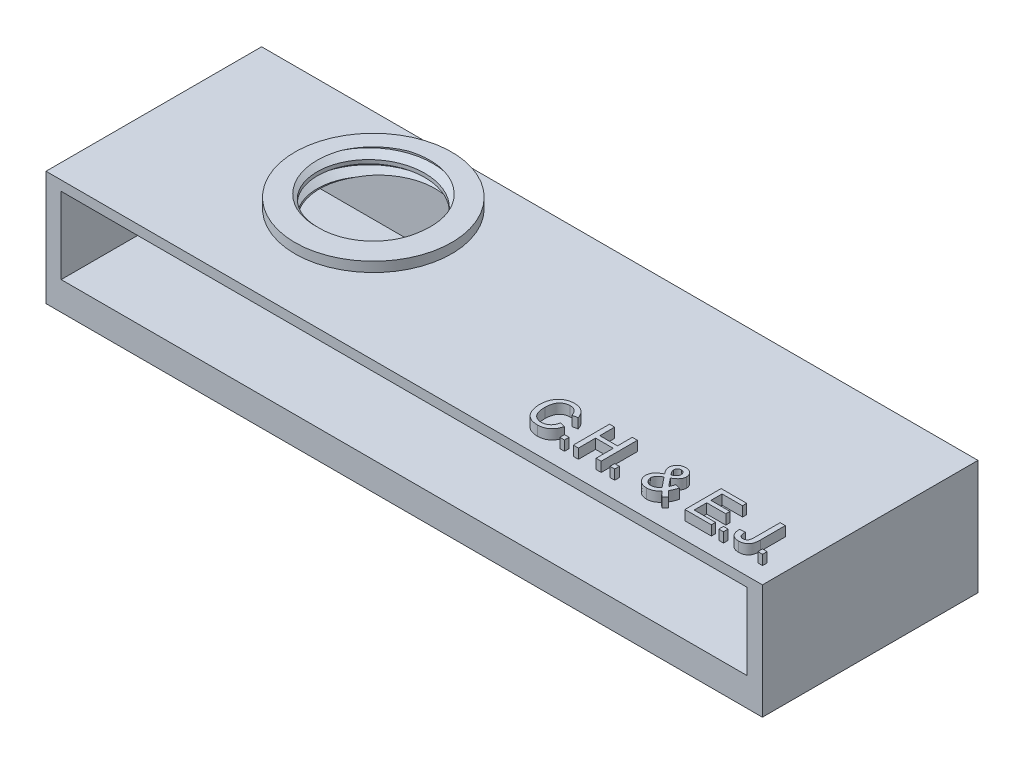
from build123d import *

# Parameters (mm, degrees)
SKIZZE1_W                       = 73.1
SKIZZE1_H                       = 22
BASIS_DEPTH                     = 11.7
SKIZZE2_W                       = 70
SKIZZE2_H                       = 7.8
HANDYSCHLITZ_DEPTH              = 21.25
SKIZZE3_R                       = 6.3
ZYLINDER_DEPTH                  = 1
SKIZZE6_R                       = 8
AUFSATZ_LINEAR_AUSTRAGEN1_DEPTH = 1
SKIZZE8_R                       = 6.3
SCHNITT_LINEAR_AUSTRAGEN2_DEPTH = 6
GEWINDE2_PITCH                  = 1.5
SKIZZE12_R                      = 7.5
SCHNITT_LINEAR_AUSTRAGEN5_DEPTH = 6
SKIZZE17_W                      = 30.300932881
SKIZZE17_H                      = 16.269400137
SCHNITT_LINEAR_AUSTRAGEN7_DEPTH = 6
EAH_JENA_DEPTH                  = 1
LOGO_DEPTH                      = 1
SKIZZE26_W                      = 0.474358974
SKIZZE26_H                      = 0.474358974
SKIZZE26_W_2                    = 0.474358975
C_H_E_J_DEPTH                   = 1


with BuildPart() as part:
    # Skizze1 → Basis (new body)
    with BuildSketch(Plane(origin=(0, 0, 0), x_dir=(1, 0, 0), z_dir=(0, 1, 0))):
        with Locations((-9.866464149, 7.203333333)):
            Rectangle(SKIZZE1_W, SKIZZE1_H)
    extrude(amount=BASIS_DEPTH)

    # Skizze2 → Handyschlitz (cut)
    with BuildSketch(Plane.XY.offset(3.796666667)):
        with Locations((-9.866464149, 6.8)):
            Rectangle(SKIZZE2_W, SKIZZE2_H)
    extrude(amount=-HANDYSCHLITZ_DEPTH, mode=Mode.SUBTRACT)

    # Skizze3 → Zylinder (add)
    with BuildSketch(Plane(origin=(0, 11.7, 0), x_dir=(1, 0, 0), z_dir=(0, 1, 0))):
        with Locations(Location((-26.416464149, 9.603333333, 0), (0, 0, 270))):
            Circle(SKIZZE3_R)
    extrude(amount=ZYLINDER_DEPTH)

    # Skizze6 → Aufsatz-Linear austragen1 (add)
    with BuildSketch(Plane(origin=(0, 11.7, 0), x_dir=(1, 0, 0), z_dir=(0, 1, 0))):
        with Locations(Location((-26.416464149, 9.603333333, 0), (0, 0, 270))):
            Circle(SKIZZE6_R)
    extrude(amount=AUFSATZ_LINEAR_AUSTRAGEN1_DEPTH)

    # Skizze8 → Schnitt-Linear austragen2 (cut)
    with BuildSketch(Plane(origin=(0, 12.7, 0), x_dir=(1, 0, 0), z_dir=(0, 1, 0))):
        with Locations(Location((-26.416464149, 9.603333333, 0), (0, 0, 270))):
            Circle(SKIZZE8_R)
    extrude(amount=-SCHNITT_LINEAR_AUSTRAGEN2_DEPTH, mode=Mode.SUBTRACT)

    # Gewinde2: the profile of Gewindeprofil2 profile screwed along a right-hand helix of 5.333333 turns, 8 arcs to a turn; built about Z, then put on its axis
    gewinde2_z = Axis((0, 0, 0), (0, 0, 1))
    gewinde2_corners = [(6.3003, 0, -0.000173205), (6.3003, 0, 1.312673201), (5.488101187, 0, 0.843749998), (5.488101187, 0, 0.468749998)]
    with BuildLine(mode=Mode.PRIVATE) as gewinde2_profile:
        Line(gewinde2_corners[0], gewinde2_corners[1])
        Line(gewinde2_corners[1], gewinde2_corners[2])
        Line(gewinde2_corners[2], gewinde2_corners[3])
        Line(gewinde2_corners[3], gewinde2_corners[0])
    gewinde2_cap = Face(gewinde2_profile.wire())
    gewinde2_turn_angles = [0, 22.5, 45, 67.5, 90, 112.5, 135, 157.5, 180, 202.5, 225, 247.5, 270, 292.5, 315, 337.5, 360]
    gewinde2_turn_weights = [1, 0.9238795325112867, 1, 0.9238795325112867, 1, 0.9238795325112867, 1, 0.9238795325112867, 1, 0.9238795325112867, 1, 0.9238795325112867, 1, 0.9238795325112867, 1, 0.9238795325112867, 1]
    gewinde2_turn_rails = [Edge.make_bspline([Vector(p[0], p[1], 0).rotate(gewinde2_z, gewinde2_turn_angles[k]) / gewinde2_turn_weights[k] + Vector(0, 0, p[2] + GEWINDE2_PITCH * gewinde2_turn_angles[k] / 360) for k in range(17)], [0, 0, 0, 1, 1, 2, 2, 3, 3, 4, 4, 5, 5, 6, 6, 7, 7, 8, 8, 8], 2, gewinde2_turn_weights) for p in gewinde2_corners]
    gewinde2_turn_sides = [Face.make_surface_from_curves(gewinde2_turn_rails[p[0]], gewinde2_turn_rails[p[1]]) for p in [(0, 1), (1, 2), (2, 3), (3, 0)]]
    gewinde2_last_angles = [1800, 1822.5, 1845, 1867.5, 1890, 1905, 1920]
    gewinde2_last_weights = [1, 0.9238795325112867, 1, 0.9238795325112867, 1, 0.9659258262890688, 1]
    gewinde2_last_rails = [Edge.make_bspline([Vector(p[0], p[1], 0).rotate(gewinde2_z, gewinde2_last_angles[k]) / gewinde2_last_weights[k] + Vector(0, 0, p[2] + GEWINDE2_PITCH * gewinde2_last_angles[k] / 360) for k in range(7)], [0, 0, 0, 1, 1, 2, 2, 3, 3, 3], 2, gewinde2_last_weights) for p in gewinde2_corners]
    gewinde2_last_sides = [Face.make_surface_from_curves(gewinde2_last_rails[p[0]], gewinde2_last_rails[p[1]]) for p in [(0, 1), (1, 2), (2, 3), (3, 0)]]
    gewinde2 = Plane(origin=(-26.416464149, 14.3, -9.603333333), x_dir=(-1, 0, 0), z_dir=(0, -1, 0)) * Solid(Shell([*[p.moved(Location((0, 0, GEWINDE2_PITCH * i))) for i in range(5) for p in gewinde2_turn_sides], *gewinde2_last_sides, gewinde2_cap, gewinde2_cap.rotate(gewinde2_z, 1920).moved(Location((0, 0, GEWINDE2_PITCH * 1920 / 360)))]))
    add(gewinde2)

    # Skizze12 → Schnitt-Linear austragen5 (cut)
    with BuildSketch(Plane(origin=(0, 12.7, 0), x_dir=(1, 0, 0), z_dir=(0, 1, 0))):
        with Locations((-26.416464149, 9.603333333)):
            Circle(SKIZZE12_R)
    extrude(amount=SCHNITT_LINEAR_AUSTRAGEN5_DEPTH, mode=Mode.SUBTRACT)

    # Skizze17 → Schnitt-Linear austragen7 (cut)
    with BuildSketch(Plane(origin=(0, 10.7, 0), x_dir=(-1, 0, 0), z_dir=(0, -1, 0))):
        with Locations((28.531838804, 8.134700069)):
            Rectangle(SKIZZE17_W, SKIZZE17_H)
    extrude(amount=SCHNITT_LINEAR_AUSTRAGEN7_DEPTH, mode=Mode.SUBTRACT)

    # Skizze25 → EAH Jena (add)
    # profile 1 of 7: a face of its own
    with BuildSketch(Plane(origin=(0, 0, 0), x_dir=(-1, 0, 0), z_dir=(0, -1, 0))):
        Polygon((6.791710178, -1.663041856), (6.791710178, 1.836958144), (9.259658895, 1.836958144), (9.259658895, 1.43311199), (7.285299921, 1.43311199), (7.285299921, 0.356188913), (9.125043511, 0.356188913), (9.125043511, -0.047657241), (7.285299921, -0.047657241), (7.285299921, -1.259195702), (9.349402485, -1.259195702), (9.349402485, -1.663041856), align=None)
    # profile 2 of 7: a face of its own
    with BuildSketch(Plane(origin=(0, 0, 0), x_dir=(-1, 0, 0), z_dir=(0, -1, 0))):
        Polygon((9.543613222, -1.663041856), (10.93323662, 1.836958144), (11.489927325, 1.836958144), (12.879550722, -1.663041856), (12.355812742, -1.663041856), (11.957575562, -0.586118779), (10.465588383, -0.586118779), (10.067351203, -1.663041856), align=None)
        with BuildLine():
            Line((10.614226203, -0.182272625), (11.808937742, -0.182272625))
            Line((11.808937742, -0.182272625), (11.468893671, 0.737599169))
            add(Edge.make_bspline(
                [(11.468893671, 0.737599169), (11.455857596, 0.773141762), (11.430369606, 0.842634241), (11.392359336, 0.943600948), (11.357633765, 1.039483076), (11.323582491, 1.128905814), (11.292843798, 1.213168117), (11.264511156, 1.291700831), (11.236490413, 1.363958117), (11.219674771, 1.410643768), (11.211581972, 1.43311199)],
                knots=[0, 0, 0, 0, 1.225184869, 2.395467751, 3.491410812, 4.525364584, 5.492066482, 6.394148129, 7.227157926, 8, 8, 8, 8], degree=3))
            add(Edge.make_bspline(
                [(11.211581972, 1.43311199), (11.198194921, 1.377707334), (11.171365621, 1.266669571), (11.115191597, 1.103984353), (11.050930465, 0.942786964), (10.998742768, 0.838912467), (10.97249944, 0.786677695)],
                knots=[0, 0, 0, 0, 0.9891762, 1.982431084, 2.985436691, 4, 4, 4, 4], degree=3))
            Line((10.97249944, 0.786677695), (10.614226203, -0.182272625))
        make_face(mode=Mode.SUBTRACT)
    # profile 3 of 7: a face of its own
    with BuildSketch(Plane(origin=(0, 0, 0), x_dir=(-1, 0, 0), z_dir=(0, -1, 0))):
        Polygon((13.253248639, -1.663041856), (13.253248639, 1.836958144), (13.746838383, 1.836958144), (13.746838383, 0.401060708), (15.451966588, 0.401060708), (15.451966588, 1.836958144), (15.945556331, 1.836958144), (15.945556331, -1.663041856), (15.451966588, -1.663041856), (15.451966588, -0.002785446), (13.746838383, -0.002785446), (13.746838383, -1.663041856), align=None)
    # profile 4 of 7: a face of its own
    with BuildSketch(Plane(origin=(0, 0, 0), x_dir=(-1, 0, 0), z_dir=(0, -1, 0))):
        with BuildLine():
            Line((17.830171716, -0.686379196), (18.32376146, -0.630990574))
            add(Edge.make_bspline(
                [(18.32376146, -0.630990574), (18.325095054, -0.662092888), (18.327646186, -0.721590801), (18.336104163, -0.807008212), (18.347911279, -0.884697448), (18.36253253, -0.954942231), (18.379565969, -1.017791317), (18.400937234, -1.072737648), (18.423953924, -1.120935667), (18.452253265, -1.16088606), (18.482595025, -1.195029748), (18.515973611, -1.224020964), (18.55195843, -1.248725405), (18.590477759, -1.269133188), (18.631964985, -1.28478687), (18.67598885, -1.295660465), (18.722912253, -1.30318799), (18.755153505, -1.303768279), (18.771778286, -1.304067497)],
                knots=[0, 0, 0, 0, 1.632619403, 3.123158228, 4.499702462, 5.75227728, 6.885496867, 7.90993266, 8.841891104, 9.678429245, 10.468404694, 11.232957398, 11.991194639, 12.753385178, 13.513799276, 14.310593147, 15.128879333, 16, 16, 16, 16], degree=3))
            add(Edge.make_bspline(
                [(18.771778286, -1.304067497), (18.795948594, -1.303258637), (18.843177355, -1.301678124), (18.910921454, -1.28543416), (18.974042611, -1.261062533), (19.030755547, -1.22547634), (19.081319043, -1.182174894), (19.124329594, -1.131076481), (19.157092165, -1.072023015), (19.177726711, -1.017500544), (19.190384105, -0.968972917), (19.198667701, -0.926815945), (19.205651202, -0.879785295), (19.210925971, -0.827586205), (19.216281114, -0.770370123), (19.218420462, -0.70788694), (19.220914052, -0.64059173), (19.221100747, -0.594067985), (19.221197357, -0.569992978)],
                knots=[0, 0, 0, 0, 1.177507829, 2.300849353, 3.381033894, 4.466744326, 5.550475886, 6.619462111, 7.707386998, 8.830091395, 9.455333453, 10.153234525, 10.925888378, 11.774835866, 12.713513529, 13.729654905, 14.82514671, 16, 16, 16, 16], degree=3))
            Line((19.221197357, -0.569992978), (19.221197357, 1.836958144))
            Line((19.221197357, 1.836958144), (19.714787101, 1.836958144))
            Line((19.714787101, 1.836958144), (19.714787101, -0.538442497))
            add(Edge.make_bspline(
                [(19.714787101, -0.538442497), (19.714585465, -0.573971391), (19.714195247, -0.64272918), (19.709274699, -0.742842863), (19.70071679, -0.83682133), (19.689966548, -0.924870761), (19.675220284, -1.006805068), (19.656977905, -1.082350925), (19.636304717, -1.152121748), (19.603857092, -1.235394111), (19.554453955, -1.329868022), (19.478858362, -1.430064774), (19.387489561, -1.515539903), (19.281383393, -1.585889093), (19.163086158, -1.640180619), (19.034637285, -1.679598823), (18.896333766, -1.703992263), (18.800627436, -1.706582551), (18.751445754, -1.707913651)],
                knots=[0, 0, 0, 0, 0.979376435, 1.895351937, 2.762129694, 3.580429744, 4.339931879, 5.055623694, 5.722093767, 6.344240595, 7.517202841, 8.648554164, 9.788057829, 10.949533591, 12.142879013, 13.363546981, 14.645176409, 16, 16, 16, 16], degree=3))
            add(Edge.make_bspline(
                [(18.751445754, -1.707913651), (18.714948055, -1.707116316), (18.643854654, -1.705563197), (18.540496883, -1.693216986), (18.443373338, -1.674648981), (18.353691663, -1.644782191), (18.269632392, -1.609837507), (18.192822629, -1.564925889), (18.121947614, -1.513107367), (18.058801793, -1.452160372), (18.0018615, -1.384064763), (17.954778148, -1.306698621), (17.913168703, -1.222861112), (17.88175556, -1.130217094), (17.855988431, -1.03048475), (17.840050493, -0.922391611), (17.82958188, -0.80694885), (17.829971513, -0.727303214), (17.830171716, -0.686379196)],
                knots=[0, 0, 0, 0, 1.110149412, 2.162445788, 3.163771351, 4.112774839, 5.033433762, 5.928696445, 6.813333667, 7.698542325, 8.592646346, 9.506220098, 10.44759987, 11.434914499, 12.476633792, 13.577933972, 14.755478919, 16, 16, 16, 16], degree=3))
        make_face()
    # profile 5 of 7: a face of its own
    with BuildSketch(Plane(origin=(0, 0, 0), x_dir=(-1, 0, 0), z_dir=(0, -1, 0))):
        Polygon((20.522479408, -1.663041856), (20.522479408, 1.836958144), (22.990428126, 1.836958144), (22.990428126, 1.43311199), (21.016069152, 1.43311199), (21.016069152, 0.356188913), (22.855812742, 0.356188913), (22.855812742, -0.047657241), (21.016069152, -0.047657241), (21.016069152, -1.259195702), (23.080171716, -1.259195702), (23.080171716, -1.663041856), align=None)
    # profile 6 of 7: a face of its own
    with BuildSketch(Plane(origin=(0, 0, 0), x_dir=(-1, 0, 0), z_dir=(0, -1, 0))):
        Polygon((23.753248639, -1.663041856), (23.753248639, 1.836958144), (24.274883254, 1.836958144), (25.951966588, -0.774720542), (25.951966588, 1.836958144), (26.445556331, 1.836958144), (26.445556331, -1.663041856), (25.923921716, -1.663041856), (24.246838383, 0.94863683), (24.246838383, -1.663041856), align=None)
    # profile 7 of 7: a face of its own
    with BuildSketch(Plane(origin=(0, 0, 0), x_dir=(-1, 0, 0), z_dir=(0, -1, 0))):
        Polygon((26.774382453, -1.663041856), (28.164005851, 1.836958144), (28.720696556, 1.836958144), (30.110319953, -1.663041856), (29.586581972, -1.663041856), (29.188344793, -0.586118779), (27.696357613, -0.586118779), (27.298120434, -1.663041856), align=None)
        with BuildLine():
            Line((27.844995434, -0.182272625), (29.039706972, -0.182272625))
            Line((29.039706972, -0.182272625), (28.699662902, 0.737599169))
            add(Edge.make_bspline(
                [(28.699662902, 0.737599169), (28.686626826, 0.773141762), (28.661138837, 0.842634241), (28.623128566, 0.943600948), (28.588402995, 1.039483076), (28.554351722, 1.128905814), (28.523613028, 1.213168117), (28.495280387, 1.291700831), (28.467259644, 1.363958117), (28.450444002, 1.410643768), (28.442351203, 1.43311199)],
                knots=[0, 0, 0, 0, 1.225184869, 2.395467751, 3.491410812, 4.525364584, 5.492066482, 6.394148129, 7.227157926, 8, 8, 8, 8], degree=3))
            add(Edge.make_bspline(
                [(28.442351203, 1.43311199), (28.428964152, 1.377707334), (28.402134851, 1.266669571), (28.345960828, 1.103984353), (28.281699695, 0.942786964), (28.229511999, 0.838912467), (28.203268671, 0.786677695)],
                knots=[0, 0, 0, 0, 0.9891762, 1.982431084, 2.985436691, 4, 4, 4, 4], degree=3))
            Line((28.203268671, 0.786677695), (27.844995434, -0.182272625))
        make_face(mode=Mode.SUBTRACT)
    extrude(amount=EAH_JENA_DEPTH)

    # Skizze24 → LOGO (add)
    with BuildSketch(Plane(origin=(0, 0, 0), x_dir=(-1, 0, 0), z_dir=(0, -1, 0))):
        Polygon((33.761487263, 1.43405578), (32.029436456, -1.56594422), (35.493538071, -1.56594422), align=None)
        Polygon((35.947767039, -1.538115831), (37.679817846, 1.461884169), (34.215716231, 1.461884169), align=None)
        Polygon((38.093112145, 1.43405578), (36.361061337, -1.56594422), (39.825162952, -1.56594422), align=None)
        Polygon((40.238164925, -1.538115831), (41.970215732, 1.461884169), (38.506114117, 1.461884169), align=None)
        Polygon((42.342197995, 1.43405578), (40.610147188, -1.56594422), (44.074248803, -1.56594422), align=None)
        Polygon((35.947458768, 4.854602398), (34.21540796, 1.854602398), (37.679509575, 1.854602398), align=None)
        Polygon((38.133781063, 1.93405578), (39.865831871, 4.93405578), (36.401730256, 4.93405578), align=None)
        Polygon((40.279078334, 4.854602398), (38.547027526, 1.854602398), (42.011129142, 1.854602398), align=None)
        Polygon((38.133781063, 8.331557422), (36.401730256, 5.331557422), (39.865831871, 5.331557422), align=None)
    extrude(amount=LOGO_DEPTH)

    # Skizze26 → C.H. & E.J. (add)
    # profile 1 of 9: a face of its own
    with BuildSketch(Plane(origin=(0, 11.7, 0), x_dir=(1, 0, 0), z_dir=(0, 1, 0))):
        with BuildLine():
            Line((3.075711078, -0.786637436), (3.59750595, -0.908191923))
            add(Edge.make_bspline(
                [(3.59750595, -0.908191923), (3.584433532, -0.957098307), (3.55886226, -1.052765264), (3.508304748, -1.189675268), (3.451560142, -1.318159468), (3.38725156, -1.437879412), (3.31467515, -1.548146786), (3.235753894, -1.650378737), (3.147361833, -1.742431365), (3.052742176, -1.826429196), (2.951158207, -1.90051506), (2.843834679, -1.964489562), (2.731290373, -2.018918877), (2.613070418, -2.063678204), (2.489098172, -2.097363435), (2.36001197, -2.121915204), (2.225435405, -2.137037665), (2.133703404, -2.139028581), (2.086969091, -2.140042885)],
                knots=[0, 0, 0, 0, 1.145254194, 2.240259345, 3.299159039, 4.322497661, 5.312016644, 6.284080175, 7.241264552, 8.196044782, 9.144516039, 10.082428046, 11.020306713, 11.970622414, 12.939253955, 13.924100776, 14.94240044, 16, 16, 16, 16], degree=3))
            add(Edge.make_bspline(
                [(2.086969091, -2.140042885), (2.039018781, -2.139346253), (1.94520783, -2.137983348), (1.807780197, -2.126897844), (1.677073022, -2.107671761), (1.553330399, -2.080959872), (1.436135826, -2.04793228), (1.325975275, -2.006380644), (1.223041698, -1.956604773), (1.126476491, -1.899996744), (1.036689799, -1.835687473), (0.951639842, -1.765412494), (0.87339135, -1.687237213), (0.799987815, -1.603007422), (0.733027992, -1.511612013), (0.670048416, -1.41429263), (0.614123082, -1.309334511), (0.563179441, -1.198683581), (0.518465118, -1.083411141), (0.478908583, -0.965794139), (0.446568953, -0.84559821), (0.418726619, -0.723834783), (0.398500512, -0.599479303), (0.382441609, -0.473464815), (0.373612101, -0.345018742), (0.372450231, -0.25867823), (0.371864925, -0.215183109)],
                knots=[0, 0, 0, 0, 1.180702053, 2.309949215, 3.392367133, 4.431746864, 5.425408375, 6.388154007, 7.326956194, 8.237882283, 9.141054626, 10.043899035, 10.951650021, 11.86168169, 12.792564695, 13.739356664, 14.713891418, 15.718426911, 16.737522708, 17.757217648, 18.772674716, 19.801476837, 20.831699174, 21.873853055, 22.928926693, 24, 24, 24, 24], degree=3))
            add(Edge.make_bspline(
                [(0.371864925, -0.215183109), (0.372702036, -0.168228372), (0.374355958, -0.075457672), (0.383692318, 0.06142819), (0.400839828, 0.193539792), (0.424652732, 0.320964035), (0.454785582, 0.443804115), (0.491981207, 0.562119878), (0.535769084, 0.67575994), (0.58601572, 0.784849613), (0.643054943, 0.888171168), (0.705184366, 0.985871486), (0.773886016, 1.076346369), (0.847122989, 1.161324367), (0.926724428, 1.239390499), (1.012447266, 1.310721605), (1.103551922, 1.375968313), (1.200025099, 1.4345249), (1.30060578, 1.485905242), (1.403800018, 1.53167016), (1.51001826, 1.569180732), (1.618418379, 1.600369264), (1.729233749, 1.625198232), (1.842723303, 1.641801441), (1.958782175, 1.652621379), (2.03703813, 1.65408774), (2.076592489, 1.65482891)],
                knots=[0, 0, 0, 0, 1.185634383, 2.342514083, 3.462112933, 4.547331452, 5.613960142, 6.653690668, 7.676612054, 8.686959706, 9.683658101, 10.654407272, 11.607580201, 12.5494388, 13.484601218, 14.419076806, 15.362504069, 16.311442244, 17.265594461, 18.212500624, 19.159571152, 20.107257795, 21.059246075, 22.024387127, 23.001429356, 24, 24, 24, 24], degree=3))
            add(Edge.make_bspline(
                [(2.076592489, 1.65482891), (2.120848487, 1.653994707), (2.207838034, 1.652354997), (2.335479696, 1.638868059), (2.457727082, 1.616278916), (2.575109911, 1.586644097), (2.686407776, 1.54606786), (2.792829008, 1.497827378), (2.893314927, 1.439872282), (2.988647398, 1.373795284), (3.077274555, 1.299474522), (3.160436641, 1.218685498), (3.234742743, 1.129409076), (3.303135834, 1.033805905), (3.36346404, 0.930550295), (3.417946775, 0.820542524), (3.464800341, 0.70296481), (3.489869332, 0.62106868), (3.502634155, 0.579368173)],
                knots=[0, 0, 0, 0, 1.098391872, 2.158997981, 3.181470371, 4.182549255, 5.160268219, 6.118029851, 7.079534476, 8.035645336, 8.993622929, 9.94770573, 10.909620999, 11.872786677, 12.862530088, 13.874594564, 14.917769567, 16, 16, 16, 16], degree=3))
            Line((3.502634155, 0.579368173), (2.980839284, 0.467449103))
            add(Edge.make_bspline(
                [(2.980839284, 0.467449103), (2.970592047, 0.499452101), (2.950535034, 0.56209187), (2.914921845, 0.651364674), (2.876460789, 0.734239002), (2.834235691, 0.810151514), (2.78815504, 0.879120391), (2.739279953, 0.941983849), (2.68643943, 0.997568531), (2.630708291, 1.047156082), (2.570647397, 1.08939993), (2.507664833, 1.126834931), (2.440432615, 1.157806686), (2.369917927, 1.184002392), (2.295461675, 1.203940147), (2.217367056, 1.217967145), (2.135565453, 1.226085283), (2.079822255, 1.22729093), (2.051392168, 1.227905833)],
                knots=[0, 0, 0, 0, 1.235697765, 2.418642872, 3.532555292, 4.594392283, 5.610119701, 6.580908344, 7.519430642, 8.427315627, 9.319973334, 10.216139639, 11.118687699, 12.038725643, 12.980015607, 13.949697744, 14.954307006, 16, 16, 16, 16], degree=3))
            add(Edge.make_bspline(
                [(2.051392168, 1.227905833), (2.018751827, 1.227432254), (1.95455791, 1.226500864), (1.860249322, 1.216306904), (1.769680276, 1.201292196), (1.68352578, 1.17877635), (1.601314389, 1.150704945), (1.523533962, 1.115751079), (1.449522862, 1.074781048), (1.380107091, 1.027548822), (1.315870027, 0.97445071), (1.255068461, 0.918317697), (1.200621543, 0.856531869), (1.150453049, 0.791130549), (1.106023883, 0.720958047), (1.066030191, 0.646970199), (1.030726903, 0.568560616), (0.992243921, 0.458205066), (0.953005363, 0.316069671), (0.918965866, 0.142142015), (0.897283509, -0.034525858), (0.894870255, -0.15335589), (0.893659796, -0.212959551)],
                knots=[0, 0, 0, 0, 0.935256702, 1.839373932, 2.716087708, 3.564631604, 4.388828665, 5.203538865, 6.005592122, 6.810952829, 7.606223804, 8.392839071, 9.180346482, 9.963639178, 10.753404291, 11.558266631, 12.372976832, 13.215232055, 14.905983541, 16.594894834, 18.292041732, 20, 20, 20, 20], degree=3))
            add(Edge.make_bspline(
                [(0.893659796, -0.212959551), (0.895025022, -0.287901181), (0.897673682, -0.433294729), (0.923809451, -0.643993995), (0.963657015, -0.840519697), (1.011747284, -0.993848902), (1.059986656, -1.106947411), (1.099000236, -1.186151928), (1.143532681, -1.259443945), (1.192476307, -1.327239697), (1.246461559, -1.389341426), (1.304736313, -1.44607902), (1.367313587, -1.497998429), (1.434934863, -1.542669211), (1.504997313, -1.58233297), (1.576616805, -1.617602742), (1.649838432, -1.647432354), (1.724957612, -1.670604603), (1.800919471, -1.690628647), (1.87856065, -1.703709293), (1.95785901, -1.711091597), (2.011105897, -1.712438317), (2.038050822, -1.713119808)],
                knots=[0, 0, 0, 0, 2.10686522, 4.087509323, 5.961373225, 7.741398778, 8.594514555, 9.418024779, 10.222433421, 11.003575649, 11.767087398, 12.533660211, 13.289033706, 14.050297079, 14.809623433, 15.552362432, 16.294320901, 17.0305302, 17.761969017, 18.502233515, 19.242073914, 20, 20, 20, 20], degree=3))
            add(Edge.make_bspline(
                [(2.038050822, -1.713119808), (2.0702059, -1.712445448), (2.133723549, -1.711113349), (2.226848488, -1.699453415), (2.316619645, -1.682270975), (2.401949456, -1.655756737), (2.483985702, -1.623293158), (2.562056238, -1.583259887), (2.635915543, -1.535111548), (2.706432365, -1.480443631), (2.772306313, -1.418240883), (2.832676244, -1.34900444), (2.886834893, -1.272418663), (2.93705359, -1.189712643), (2.979246525, -1.098415644), (3.018327145, -1.001248829), (3.050891941, -0.896615174), (3.067319189, -0.823823297), (3.075711078, -0.786637436)],
                knots=[0, 0, 0, 0, 1.013374089, 2.001772144, 2.95501459, 3.891367103, 4.814208647, 5.733921849, 6.652182523, 7.590185968, 8.54346024, 9.504121027, 10.481158517, 11.497760682, 12.549996529, 13.647863555, 14.798406869, 16, 16, 16, 16], degree=3))
        make_face()
    # profile 2 of 9: a face of its own
    with BuildSketch(Plane(origin=(0, 11.7, 0), x_dir=(1, 0, 0), z_dir=(0, 1, 0))):
        with Locations((4.546223899, -1.8554275)):
            Rectangle(SKIZZE26_W, SKIZZE26_H)
    # profile 3 of 9: a face of its own
    with BuildSketch(Plane(origin=(0, 11.7, 0), x_dir=(1, 0, 0), z_dir=(0, 1, 0))):
        Polygon((5.684685437, -2.092606987), (5.684685437, 1.607393013), (6.206480309, 1.607393013), (6.206480309, 0.089444295), (8.009044412, 0.089444295), (8.009044412, 1.607393013), (8.530839284, 1.607393013), (8.530839284, -2.092606987), (8.009044412, -2.092606987), (8.009044412, -0.337478782), (6.206480309, -0.337478782), (6.206480309, -2.092606987), align=None)
    # profile 4 of 9: a face of its own
    with BuildSketch(Plane(origin=(0, 11.7, 0), x_dir=(1, 0, 0), z_dir=(0, 1, 0))):
        with Locations((9.669300822, -1.8554275)):
            Rectangle(SKIZZE26_W, SKIZZE26_H)
    # profile 5 of 9: a face of its own
    with BuildSketch(Plane(origin=(0, 11.7, 0), x_dir=(1, 0, 0), z_dir=(0, 1, 0))):
        with BuildLine():
            add(Edge.make_bspline(
                [(14.274288803, -1.623436314), (14.236749524, -1.664462929), (14.163257436, -1.744782311), (14.042552731, -1.849998573), (13.917470321, -1.940290358), (13.786477409, -2.013029645), (13.65060685, -2.070196079), (13.509204053, -2.110053588), (13.362562531, -2.135543554), (13.262675527, -2.138531887), (13.212169412, -2.140042885)],
                knots=[0, 0, 0, 0, 1.093164284, 2.140129739, 3.143504165, 4.122525029, 5.081066102, 6.036361366, 7.007120508, 8, 8, 8, 8], degree=3))
            add(Edge.make_bspline(
                [(13.212169412, -2.140042885), (13.165909178, -2.138970887), (13.075747117, -2.136881543), (12.944142423, -2.118648824), (12.820070528, -2.088999846), (12.70258584, -2.048568671), (12.593263009, -1.994563428), (12.490632385, -1.929585812), (12.395281166, -1.852701131), (12.339129135, -1.792870963), (12.31088736, -1.762779263)],
                knots=[0, 0, 0, 0, 1.100470892, 2.144838377, 3.154486211, 4.132569556, 5.094958372, 6.049140531, 7.018811397, 8, 8, 8, 8], degree=3))
            add(Edge.make_bspline(
                [(12.31088736, -1.762779263), (12.289477049, -1.736907866), (12.247436665, -1.68610788), (12.19217435, -1.605403866), (12.145441194, -1.522609076), (12.107263764, -1.437246516), (12.077347802, -1.349730381), (12.056934742, -1.259754654), (12.043696914, -1.167750925), (12.041969577, -1.105640225), (12.041095694, -1.074217564)],
                knots=[0, 0, 0, 0, 1.065358646, 2.091893341, 3.099477229, 4.078716359, 5.055661193, 6.029485947, 7.003089712, 8, 8, 8, 8], degree=3))
            add(Edge.make_bspline(
                [(12.041095694, -1.074217564), (12.041925717, -1.046278276), (12.043561268, -0.991224234), (12.053039085, -0.909506261), (12.07071677, -0.830168624), (12.092965327, -0.752154885), (12.124100415, -0.676802044), (12.161200875, -0.603572428), (12.204195592, -0.531781021), (12.254957897, -0.462915758), (12.312438384, -0.396036572), (12.376168238, -0.330767612), (12.446806803, -0.26770639), (12.524049835, -0.207201318), (12.607357031, -0.148071855), (12.698043309, -0.092480772), (12.794426087, -0.036824502), (12.862373102, -0.003315148), (12.897165405, 0.013843333)],
                knots=[0, 0, 0, 0, 0.915018781, 1.803033897, 2.688392046, 3.574045808, 4.455848883, 5.353064954, 6.260398892, 7.19238917, 8.150553927, 9.145935903, 10.177161104, 11.248536403, 12.357283344, 13.520048458, 14.730139544, 16, 16, 16, 16], degree=3))
            add(Edge.make_bspline(
                [(12.897165405, 0.013843333), (12.878828843, 0.037271881), (12.843315936, 0.082646573), (12.792629914, 0.149226601), (12.747503283, 0.212832413), (12.707374794, 0.273398358), (12.670994297, 0.329902724), (12.639763392, 0.383277246), (12.613557189, 0.433251983), (12.58532489, 0.494556618), (12.557426586, 0.568639844), (12.533967855, 0.656315804), (12.517678602, 0.742319799), (12.516190461, 0.799428661), (12.515454668, 0.827665449)],
                knots=[0, 0, 0, 0, 1.168292938, 2.262664013, 3.285595573, 4.230065678, 5.115538581, 5.924229713, 6.657599296, 7.330460229, 8.573844772, 9.760007627, 10.892462829, 12, 12, 12, 12], degree=3))
            add(Edge.make_bspline(
                [(12.515454668, 0.827665449), (12.515999697, 0.855148108), (12.517076164, 0.909428167), (12.530712954, 0.989259715), (12.550116851, 1.066467721), (12.578821457, 1.140704442), (12.615600906, 1.211880344), (12.658904777, 1.281467523), (12.712651576, 1.346424898), (12.771869745, 1.409413939), (12.838159123, 1.466432021), (12.908675732, 1.517531698), (12.984223945, 1.559786868), (13.063554666, 1.594834184), (13.147360006, 1.621544052), (13.235198652, 1.640653924), (13.327198169, 1.652983169), (13.390014149, 1.654207131), (13.421925021, 1.65482891)],
                knots=[0, 0, 0, 0, 0.964773243, 1.905490621, 2.838442154, 3.759192401, 4.695048573, 5.651344959, 6.633121115, 7.65260708, 8.686704549, 9.701112235, 10.708097826, 11.722839901, 12.744320586, 13.793472898, 14.87907178, 16, 16, 16, 16], degree=3))
            add(Edge.make_bspline(
                [(13.421925021, 1.65482891), (13.452355984, 1.654180163), (13.511946312, 1.652909777), (13.599133261, 1.64108179), (13.682581898, 1.624097802), (13.761224985, 1.597498135), (13.836243251, 1.56529829), (13.905924122, 1.52369866), (13.972409268, 1.476436572), (14.03342516, 1.421655335), (14.088456747, 1.362106756), (14.137285921, 1.299254837), (14.179036211, 1.233484942), (14.212473088, 1.163966775), (14.238468897, 1.091913167), (14.257169079, 1.016946238), (14.268516647, 0.938945277), (14.269887656, 0.885763085), (14.270582873, 0.858795256)],
                knots=[0, 0, 0, 0, 1.123791971, 2.200624789, 3.246281673, 4.265339271, 5.262698678, 6.256919688, 7.25765751, 8.27278209, 9.280532237, 10.250139998, 11.210073034, 12.153234139, 13.094626374, 14.035620154, 15.003894765, 16, 16, 16, 16], degree=3))
            add(Edge.make_bspline(
                [(14.270582873, 0.858795256), (14.269935309, 0.836788964), (14.268650337, 0.793121503), (14.260689256, 0.727958982), (14.24531569, 0.664757115), (14.226239554, 0.601961551), (14.200181378, 0.541124204), (14.168740895, 0.48112177), (14.131407585, 0.422493092), (14.088717368, 0.364872489), (14.039577462, 0.308960936), (13.986112383, 0.25324645), (13.925329983, 0.200265421), (13.860265405, 0.147225907), (13.788649354, 0.096263673), (13.711789133, 0.046021213), (13.629337767, -0.003218383), (13.571546534, -0.03361519), (13.541997136, -0.049157468)],
                knots=[0, 0, 0, 0, 0.861148472, 1.70879154, 2.562256628, 3.402982304, 4.273679903, 5.147056083, 6.050768824, 6.990318587, 7.949648442, 8.961312249, 10.008866095, 11.101815886, 12.244580615, 13.445664923, 14.693935717, 16, 16, 16, 16], degree=3))
            Line((13.541997136, -0.049157468), (14.209064444, -0.880026859))
            add(Edge.make_bspline(
                [(14.209064444, -0.880026859), (14.230571539, -0.84235794), (14.274424164, -0.765551615), (14.327092613, -0.640906926), (14.375544007, -0.508850469), (14.400263385, -0.416516116), (14.412890566, -0.369349776)],
                knots=[0, 0, 0, 0, 0.942661657, 1.922072078, 2.938550464, 4, 4, 4, 4], degree=3))
            Line((14.412890566, -0.369349776), (14.88724954, -0.469409872))
            add(Edge.make_bspline(
                [(14.88724954, -0.469409872), (14.877098835, -0.508259612), (14.857166937, -0.584544863), (14.823943065, -0.695924622), (14.787482461, -0.801602304), (14.749546523, -0.90222729), (14.706541498, -0.996056931), (14.663405396, -1.085377158), (14.616649183, -1.168820528), (14.582421651, -1.2211549), (14.56557486, -1.246913878)],
                knots=[0, 0, 0, 0, 1.139557996, 2.237633175, 3.297547274, 4.31192991, 5.288002333, 6.225615005, 7.126647716, 8, 8, 8, 8], degree=3))
            add(Edge.make_bspline(
                [(14.56557486, -1.246913878), (14.607251166, -1.299744242), (14.689645978, -1.404190831), (14.826294256, -1.547144108), (14.970017721, -1.678144449), (15.073120205, -1.754947128), (15.124429027, -1.793167885)],
                knots=[0, 0, 0, 0, 1.028924747, 2.034202902, 3.021723538, 4, 4, 4, 4], degree=3))
            Line((15.124429027, -1.793167885), (14.792377745, -2.140042885))
            add(Edge.make_bspline(
                [(14.792377745, -2.140042885), (14.749491966, -2.108207335), (14.659824316, -2.041644034), (14.532041213, -1.921011276), (14.401591687, -1.780896688), (14.317876627, -1.677349901), (14.274288803, -1.623436314)],
                knots=[0, 0, 0, 0, 0.872411164, 1.824079249, 2.867065851, 4, 4, 4, 4], degree=3))
        make_face()
        with BuildLine():
            add(Edge.make_bspline(
                [(13.309264764, 0.240646218), (13.333827441, 0.254304185), (13.380871005, 0.28046255), (13.447058184, 0.320995583), (13.507025329, 0.358952122), (13.560114785, 0.396409477), (13.606677056, 0.432171885), (13.646159132, 0.467226462), (13.679385318, 0.500477087), (13.713504583, 0.543532715), (13.746095249, 0.598820132), (13.776107232, 0.667197544), (13.792505746, 0.739940564), (13.794972876, 0.78929675), (13.796223899, 0.814324103)],
                knots=[0, 0, 0, 0, 1.271792556, 2.43579536, 3.512067756, 4.483055973, 5.375475791, 6.167548077, 6.871271346, 7.499925424, 8.648574742, 9.765884326, 10.867132895, 12, 12, 12, 12], degree=3))
            add(Edge.make_bspline(
                [(13.796223899, 0.814324103), (13.794715288, 0.843329515), (13.791785731, 0.899654829), (13.771552067, 0.980520956), (13.733476921, 1.05160152), (13.684297299, 1.114106482), (13.623324101, 1.164298592), (13.554590072, 1.201772573), (13.478086831, 1.223737842), (13.424782445, 1.226493605), (13.397465886, 1.227905833)],
                knots=[0, 0, 0, 0, 1.083649433, 2.1043278, 3.082572745, 4.07413364, 5.057198304, 6.010979397, 6.980699265, 8, 8, 8, 8], degree=3))
            add(Edge.make_bspline(
                [(13.397465886, 1.227905833), (13.369423625, 1.226441572), (13.314996208, 1.223599577), (13.236445284, 1.202540501), (13.166092635, 1.16550245), (13.104627676, 1.115479154), (13.053313864, 1.056112989), (13.016175574, 0.987928924), (12.994010458, 0.913024005), (12.991231519, 0.860920497), (12.989813643, 0.834336122)],
                knots=[0, 0, 0, 0, 1.064732527, 2.066546696, 3.061478495, 4.062632954, 5.061320643, 6.023117715, 6.99135042, 8, 8, 8, 8], degree=3))
            add(Edge.make_bspline(
                [(12.989813643, 0.834336122), (12.991918215, 0.805728755), (12.99630634, 0.746081167), (13.02619716, 0.655433104), (13.073626816, 0.5607076), (13.116199101, 0.499297801), (13.138792008, 0.466707917)],
                knots=[0, 0, 0, 0, 0.851934298, 1.7763196, 2.819903515, 4, 4, 4, 4], degree=3))
            Line((13.138792008, 0.466707917), (13.309264764, 0.240646218))
        make_face(mode=Mode.SUBTRACT)
        with BuildLine():
            Line((13.954096495, -1.305467564), (13.132121335, -0.278925096))
            add(Edge.make_bspline(
                [(13.132121335, -0.278925096), (13.102844851, -0.296266852), (13.04650175, -0.329641364), (12.966785233, -0.381253193), (12.894138725, -0.43106158), (12.829338724, -0.481124299), (12.771695791, -0.529814489), (12.720777743, -0.576920488), (12.678232706, -0.624081771), (12.63178135, -0.683971157), (12.585810052, -0.758693664), (12.54591469, -0.849187756), (12.520463988, -0.93942725), (12.517107569, -0.999944244), (12.515454668, -1.02974641)],
                knots=[0, 0, 0, 0, 1.203568211, 2.316287951, 3.358764306, 4.318456418, 5.21144218, 6.027559373, 6.770070086, 7.455339289, 8.706942094, 9.861436946, 10.946844384, 12, 12, 12, 12], degree=3))
            add(Edge.make_bspline(
                [(12.515454668, -1.02974641), (12.517724661, -1.066299552), (12.522415188, -1.141829964), (12.558347756, -1.254717123), (12.614371403, -1.369200938), (12.676819772, -1.463049429), (12.73692697, -1.534970433), (12.788480857, -1.582748692), (12.84443564, -1.623203363), (12.905332099, -1.655993097), (12.970361628, -1.682174217), (13.040485294, -1.699608164), (13.114688615, -1.711182641), (13.165922499, -1.712463784), (13.192157393, -1.713119808)],
                knots=[0, 0, 0, 0, 1.234230147, 2.550311916, 3.969910911, 5.53595692, 6.347722212, 7.133813204, 7.90575376, 8.675703375, 9.466748957, 10.269004423, 11.113624024, 12, 12, 12, 12], degree=3))
            add(Edge.make_bspline(
                [(13.192157393, -1.713119808), (13.226093132, -1.71150209), (13.295300667, -1.708202964), (13.399618669, -1.686849876), (13.504950957, -1.650228482), (13.61020497, -1.601368375), (13.710771751, -1.540552902), (13.803701515, -1.471696765), (13.885503685, -1.393485537), (13.931303705, -1.334715166), (13.954096495, -1.305467564)],
                knots=[0, 0, 0, 0, 0.911790577, 1.859478536, 2.848146299, 3.902378421, 4.971302936, 6.000153631, 7.004758516, 8, 8, 8, 8], degree=3))
        make_face(mode=Mode.SUBTRACT)
    # profile 6 of 9: a face of its own
    with BuildSketch(Plane(origin=(0, 11.7, 0), x_dir=(1, 0, 0), z_dir=(0, 1, 0))):
        Polygon((17.069300822, -2.092606987), (17.069300822, 1.607393013), (19.678275181, 1.607393013), (19.678275181, 1.180469936), (17.591095694, 1.180469936), (17.591095694, 0.042008397), (19.535967489, 0.042008397), (19.535967489, -0.38491468), (17.591095694, -0.38491468), (17.591095694, -1.66568391), (19.773146976, -1.66568391), (19.773146976, -2.092606987), align=None)
    # profile 7 of 9: a face of its own
    with BuildSketch(Plane(origin=(0, 11.7, 0), x_dir=(1, 0, 0), z_dir=(0, 1, 0))):
        with Locations((20.769300822, -1.8554275)):
            Rectangle(SKIZZE26_W, SKIZZE26_H)
    # profile 8 of 9: a face of its own
    with BuildSketch(Plane(origin=(0, 11.7, 0), x_dir=(1, 0, 0), z_dir=(0, 1, 0))):
        with BuildLine():
            Line((21.623146976, -1.060135032), (22.144941848, -1.001581346))
            add(Edge.make_bspline(
                [(22.144941848, -1.001581346), (22.146351648, -1.034460935), (22.149048558, -1.097358728), (22.157989849, -1.187657134), (22.170471657, -1.269785756), (22.185928408, -1.344044526), (22.203935186, -1.410484988), (22.226527666, -1.46857111), (22.250859596, -1.519523301), (22.280776042, -1.561756574), (22.312851616, -1.59785133), (22.34813755, -1.628499187), (22.386178645, -1.654615311), (22.426899079, -1.676189252), (22.470757003, -1.692737431), (22.517296518, -1.704232374), (22.566901258, -1.712190043), (22.600984867, -1.712803491), (22.618559636, -1.713119808)],
                knots=[0, 0, 0, 0, 1.632619403, 3.123158228, 4.499702462, 5.75227728, 6.885496867, 7.90993266, 8.841891104, 9.678429245, 10.468404694, 11.232957398, 11.991194639, 12.753385178, 13.513799276, 14.310593147, 15.128879333, 16, 16, 16, 16], degree=3))
            add(Edge.make_bspline(
                [(22.618559636, -1.713119808), (22.644111104, -1.712264727), (22.694038652, -1.710593899), (22.765653841, -1.693421709), (22.832381922, -1.667657417), (22.892335597, -1.630037727), (22.945788436, -1.584261913), (22.991256733, -1.530243591), (23.025891451, -1.467815641), (23.047705114, -1.4101776), (23.061085787, -1.358876966), (23.069842731, -1.314311024), (23.07722529, -1.264592909), (23.082801474, -1.209411013), (23.088462625, -1.14892544), (23.090724221, -1.08287179), (23.093360302, -1.011731139), (23.093557665, -0.962548895), (23.093659796, -0.937098173)],
                knots=[0, 0, 0, 0, 1.177507829, 2.300849353, 3.381033894, 4.466744326, 5.550475886, 6.619462111, 7.707386998, 8.830091395, 9.455333453, 10.153234525, 10.925888378, 11.774835866, 12.713513529, 13.729654905, 14.82514671, 16, 16, 16, 16], degree=3))
            Line((23.093659796, -0.937098173), (23.093659796, 1.607393013))
            Line((23.093659796, 1.607393013), (23.615454668, 1.607393013))
            Line((23.615454668, 1.607393013), (23.615454668, -0.903744808))
            add(Edge.make_bspline(
                [(23.615454668, -0.903744808), (23.615241511, -0.941303924), (23.614828994, -1.013990729), (23.609627272, -1.119825195), (23.60058034, -1.219173859), (23.589215799, -1.312254686), (23.573626891, -1.398870954), (23.55434209, -1.478733717), (23.532487577, -1.552491444), (23.498185802, -1.640522228), (23.445959628, -1.740394648), (23.366044288, -1.846316929), (23.269454412, -1.93667635), (23.157285034, -2.011045495), (23.032227957, -2.068439394), (22.896439149, -2.110110067), (22.750232571, -2.135897417), (22.649057309, -2.138635722), (22.597065245, -2.140042885)],
                knots=[0, 0, 0, 0, 0.979376435, 1.895351937, 2.762129694, 3.580429744, 4.339931879, 5.055623694, 5.722093767, 6.344240595, 7.517202841, 8.648554164, 9.788057829, 10.949533591, 12.142879013, 13.363546981, 14.645176409, 16, 16, 16, 16], degree=3))
            add(Edge.make_bspline(
                [(22.597065245, -2.140042885), (22.558481962, -2.139199988), (22.483326081, -2.137558119), (22.374062152, -2.12450641), (22.271388691, -2.104877376), (22.176582349, -2.073303912), (22.087719691, -2.03636239), (22.006520798, -1.988884393), (21.931595782, -1.934104813), (21.864841629, -1.869675133), (21.804647605, -1.797688345), (21.754873775, -1.715901281), (21.710886648, -1.627273058), (21.677678468, -1.529335096), (21.650438932, -1.423903761), (21.633590254, -1.309633871), (21.622523435, -1.18759438), (21.622935332, -1.103397565), (21.623146976, -1.060135032)],
                knots=[0, 0, 0, 0, 1.110149412, 2.162445788, 3.163771351, 4.112774839, 5.033433762, 5.928696445, 6.813333667, 7.698542325, 8.592646346, 9.506220098, 10.44759987, 11.434914499, 12.476633792, 13.577933972, 14.755478919, 16, 16, 16, 16], degree=3))
        make_face()
    # profile 9 of 9: a face of its own
    with BuildSketch(Plane(origin=(0, 11.7, 0), x_dir=(1, 0, 0), z_dir=(0, 1, 0))):
        with Locations((24.753916207, -1.8554275)):
            Rectangle(SKIZZE26_W_2, SKIZZE26_H)
    extrude(amount=C_H_E_J_DEPTH)


solid = part.part
